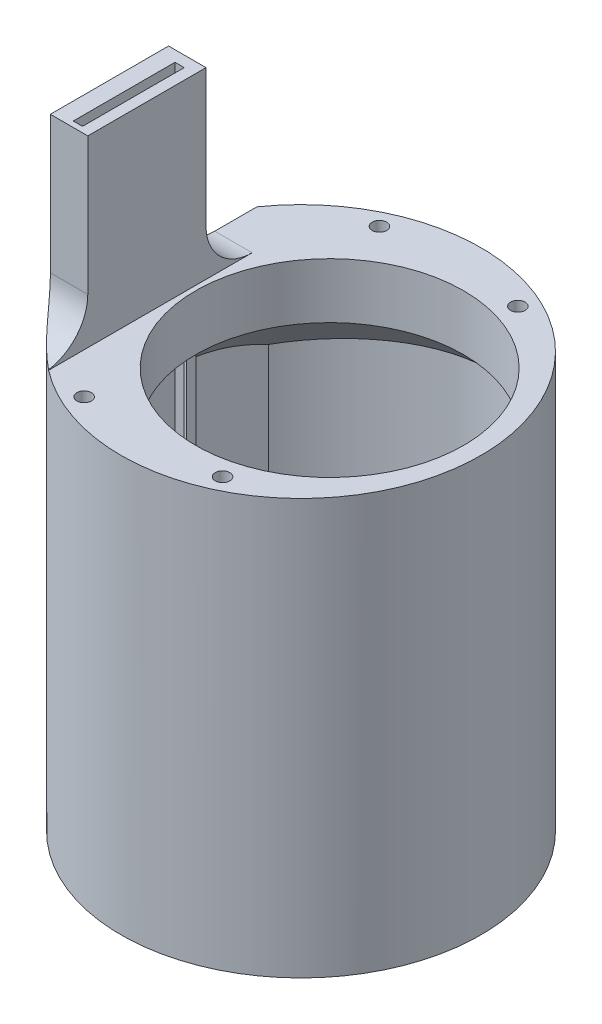
from build123d import *

# Parameters (mm, degrees)
BOSS_EXTRUDE1_DEPTH             = 57.15
SHELL3_T                        = -4.7625
SKETCH2_R                       = 7.9375
CUT_EXTRUDE3_DEPTH              = 7.62
SKETCH10_R                      = 62.285500016
CUT_EXTRUDE4_DEPTH              = 148.876474109
CUT_EXTRUDE5_REACH              = 136.056
SKETCH11_W                      = 2.54
SKETCH11_H                      = 28
SKETCH12_W                      = 10.3025
SKETCH12_H                      = 32.544335252
SKETCH12_W_2                    = 2.54
SKETCH12_H_2                    = 28
BOSS_EXTRUDE3_DEPTH             = 50.4825
FILLET1_R                       = 12.7
CBORE_FOR_M3_SBHCS1_D           = 3.4
CBORE_FOR_M3_SBHCS1_DEPTH       = 10.16
CBORE_FOR_M3_SBHCS1_CBORE_D     = 4
CBORE_FOR_M3_SBHCS1_CBORE_DEPTH = 6
CBORE_FOR_M3_SBHCS1_TIP         = 1.021463052
BOSS_EXTRUDE5_REACH             = 176.679
SKETCH20_R                      = 3.53
BOSS_EXTRUDE6_DEPTH             = 10
FILLET2_R                       = 3
FILLET3_R                       = 2
CBORE_FOR_M3_SHCS1_D            = 3.4
CBORE_FOR_M3_SHCS1_DEPTH        = 7.0000114
CBORE_FOR_M3_SHCS1_CBORE_D      = 4
CBORE_FOR_M3_SHCS1_CBORE_DEPTH  = 6
CBORE_FOR_M3_SHCS1_TIP          = 1.021463052


with BuildPart() as part:
    # Sketch1 → Boss-Extrude1 (new, symmetric)
    with BuildSketch(Plane(origin=(0, 0, 0), x_dir=(1, 0, 0), z_dir=(0, 1, 0))):
        with BuildLine():
            Line((-40.564275689, -28.421126611), (-40.564275689, 28.421126611))
            ThreePointArc((-40.564275689, 28.421126611), (49.53, 0), (-40.564275689, -28.421126611))
        make_face()
    extrude(amount=BOSS_EXTRUDE1_DEPTH, both=True)

    # Shell3
    shell3_openings = [part.faces().sort_by_distance(p)[0] for p in [
        (2.079311546, 57.15, 0),
    ]]
    offset(amount=SHELL3_T, openings=shell3_openings)

    # Sketch2 → Cut-Extrude3 (cut)
    with BuildSketch(Plane.XZ.offset(57.15)):
        with Locations(Location((-21.831775689, -17.8352577, 0), (0, 0, 270))):
            Circle(SKETCH2_R)
    extrude(amount=-CUT_EXTRUDE3_DEPTH, mode=Mode.SUBTRACT)

    # Sketch9 → Revolve1 (revolve)
    with BuildSketch(Plane.XY, mode=Mode.PRIVATE) as revolve1_sk:
        Polygon((-29.003500032, 57.15), (-29.003500032, 41.91), (-54.403500032, 16.51), (-54.403500032, 57.15), align=None)
    revolve(revolve1_sk.sketch.rotate(Axis((7.881999984, 57.15, 0), (0, 1, 0)), 270), axis=Axis((7.881999984, 57.15, 0), (0, 1, 0)))

    # Sketch10 → Cut-Extrude4 (cut, through all)
    with BuildSketch(Plane.XZ.offset(57.15)):
        with Locations((7.881999984, 0)):
            Circle(SKETCH10_R)
        with BuildLine():
            Line((-40.564275689, 28.421126611), (-40.564275689, -28.421126611))
            ThreePointArc((-40.564275689, -28.421126611), (49.53, 0), (-40.564275689, 28.421126611))
        make_face(mode=Mode.SUBTRACT)
    extrude(amount=-CUT_EXTRUDE4_DEPTH, mode=Mode.SUBTRACT)

    # Cut-Extrude5: up to this cone (the profile starts outside it)
    cut_extrude5_end = Plane(origin=(7.881999984, 57.15, 0), z_dir=(0, -1, 0)).offset(-21.645499016) * Cone(1e-06, 179.847000032, 179.846999032, align=(Align.CENTER, Align.CENTER, Align.MIN), mode=Mode.PRIVATE)
    # Sketch11 → Cut-Extrude5 (cut, up to the surface)
    with BuildSketch(Plane(origin=(0, 57.15, 0), x_dir=(1, 0, 0), z_dir=(0, 1, 0)), mode=Mode.PRIVATE) as cut_extrude5_sk1:
        with Locations((-34.531775689, -12.876791359)):
            Rectangle(SKETCH11_W, SKETCH11_H)
    cut_extrude5_tool1 = extrude(cut_extrude5_sk1.sketch, amount=-CUT_EXTRUDE5_REACH, mode=Mode.PRIVATE) - cut_extrude5_end
    add(cut_extrude5_tool1.solids().sort_by_distance((-34.531776, 57.15, 12.876791))[0], mode=Mode.SUBTRACT)

    # Sketch12 → Boss-Extrude3 (add)
    with BuildSketch(Plane(origin=(0, 57.15, 0), x_dir=(1, 0, 0), z_dir=(0, 1, 0))):
        with Locations((-35.413025689, -12.148958985)):
            Rectangle(SKETCH12_W, SKETCH12_H)
        with Locations((-34.531775689, -12.876791359)):
            Rectangle(SKETCH12_W_2, SKETCH12_H_2, mode=Mode.SUBTRACT)
    extrude(amount=BOSS_EXTRUDE3_DEPTH)

    # Fillet1
    # the kernel refuses this fillet: 12.7 mm, written as the material it adds along each edge
    with BuildSketch(Plane(origin=(-40.564275689, 57.15, 28.421126611), x_dir=(0, 1, 0), z_dir=(1, 0, 0))) as fillet1_piece_1_section:
        with BuildLine():
            CenterArc((FILLET1_R, FILLET1_R), FILLET1_R, 180, 90)
            Line((0, FILLET1_R), (0, 0))
            Line((0, 0), (FILLET1_R, 0))
        make_face()
    fillet1_piece_1 = extrude(amount=10.3025, mode=Mode.PRIVATE)
    fillet1_piece_1 = fillet1_piece_1 & Plane(origin=(0, 60.497255445, 0), x_dir=(-0.8189839630344018, 0, -0.5738164064336831), z_dir=(0, 1, 0)) * Cylinder(49.53, 72, mode=Mode.PRIVATE)
    add(fillet1_piece_1)
    with BuildSketch(Plane(origin=(-30.261775689, 57.15, -4.123208641), x_dir=(0, 1, 0), z_dir=(-1, 0, 0))) as fillet1_piece_2:
        with BuildLine():
            CenterArc((FILLET1_R, FILLET1_R), FILLET1_R, 180, 90)
            Line((0, FILLET1_R), (0, 0))
            Line((0, 0), (FILLET1_R, 0))
        make_face()
    extrude(amount=10.3025)

    # CBORE for M3 SBHCS1
    with Locations(Plane(origin=(0, 57.15, 0), x_dir=(1, 0, 0), z_dir=(0, 1, 0))):
        with Locations((-19.05, 40.64), (19.05, 40.64), (19.05, -40.64), (-19.05, -40.64)):
            CounterBoreHole(CBORE_FOR_M3_SBHCS1_D / 2, CBORE_FOR_M3_SBHCS1_CBORE_D / 2, CBORE_FOR_M3_SBHCS1_CBORE_DEPTH, depth=CBORE_FOR_M3_SBHCS1_DEPTH)
            with Locations((0, 0, -(CBORE_FOR_M3_SBHCS1_DEPTH + CBORE_FOR_M3_SBHCS1_TIP / 2))):  # 118° drill point
                Cone(0, CBORE_FOR_M3_SBHCS1_D / 2, CBORE_FOR_M3_SBHCS1_TIP, mode=Mode.SUBTRACT)

    # Boss-Extrude5: up to this cone (the profile starts inside it)
    boss_extrude5_end = Plane(origin=(7.881999984, -52.3875, 0), z_dir=(0, -1, 0)).offset(-131.182999016) * Cone(1e-06, 439.545000032, 439.544999032, align=(Align.CENTER, Align.CENTER, Align.MIN), mode=Mode.PRIVATE)
    # Sketch18 → Boss-Extrude5 (add, up to the surface)
    with BuildSketch(Plane(origin=(0, -52.3875, 0), x_dir=(1, 0, 0), z_dir=(0, 1, 0)), mode=Mode.PRIVATE) as boss_extrude5_sk1:
        with BuildLine():
            Line((-35.801775689, -26.876791359), (-33.261775689, -26.876791359))
            Line((-33.261775689, -26.876791359), (-29.326605326, -23.574791359))
            Line((-29.326605326, -23.574791359), (-29.326605326, -26.114791359))
            Line((-29.326605326, -26.114791359), (-33.540515014, -29.650681423))
            ThreePointArc((-33.540515014, -29.650681423), (-34.698875147, -28.286341576), (-35.801775689, -26.876791359))
        make_face()
    boss_extrude5_tool1 = extrude(boss_extrude5_sk1.sketch, amount=BOSS_EXTRUDE5_REACH, mode=Mode.PRIVATE) & boss_extrude5_end
    add(boss_extrude5_tool1.solids().sort_by_distance((-32.100931, -52.3875, 26.890784))[0])
    # Sketch18 → Boss-Extrude5 (add, up to the surface)
    with BuildSketch(Plane(origin=(0, -52.3875, 0), x_dir=(1, 0, 0), z_dir=(0, 1, 0)), mode=Mode.PRIVATE) as boss_extrude5_sk2:
        Polygon((-35.801775689, 3.663208641), (-33.261775689, 3.663208641), (-29.326605326, 0.361208641), (-29.326605326, -2.178791359), (-33.261775689, 1.123208641), (-35.801775689, 1.123208641), align=None)
    boss_extrude5_tool2 = extrude(boss_extrude5_sk2.sketch, amount=BOSS_EXTRUDE5_REACH, mode=Mode.PRIVATE) & boss_extrude5_end
    add(boss_extrude5_tool2.solids().sort_by_distance((-32.564191, -52.3875, -1.389843))[0])

    # Sketch20 → Boss-Extrude6 (add)
    with BuildSketch(Plane(origin=(0, -57.15, 0), x_dir=(-1, 0, 0), z_dir=(0, -1, 0))):
        with Locations((-27.331300737, 37)):
            Circle(SKETCH20_R)
        with Locations((24.392621835, 39)):
            Circle(SKETCH20_R)
        with Locations((-27.331300737, -37)):
            Circle(SKETCH20_R)
        with Locations((24.392621835, -39)):
            Circle(SKETCH20_R)
    extrude(amount=-BOSS_EXTRUDE6_DEPTH)

    # Fillet2
    fillet2_edges = [part.edges().sort_by_distance(p)[0] for p in [
        (25.233920485, -52.3875, -34.160652174),
        (-22.520753247, -52.3875, -36.007173913),
        (25.233920485, -52.3875, 34.160652174),
        (-22.520753247, -52.3875, 36.007173913),
    ]]
    fillet(fillet2_edges, radius=FILLET2_R)

    # Fillet3
    fillet3_edges = [part.edges().sort_by_distance(p)[0] for p in [
        (25.233920485, -47.15, -34.160652174),
        (-22.520753247, -47.15, -36.007173913),
        (25.233920485, -47.15, 34.160652174),
        (-22.520753247, -47.15, 36.007173913),
    ]]
    fillet(fillet3_edges, radius=FILLET3_R)

    # CBORE for M3 SHCS1
    with Locations(Plane(origin=(0, -57.15, 0), x_dir=(-1, 0, 0), z_dir=(0, -1, 0))):
        with Locations((24.392621835, -39), (-27.331300737, -37), (-27.331300737, 37), (24.392621835, 39)):
            CounterBoreHole(CBORE_FOR_M3_SHCS1_D / 2, CBORE_FOR_M3_SHCS1_CBORE_D / 2, CBORE_FOR_M3_SHCS1_CBORE_DEPTH, depth=CBORE_FOR_M3_SHCS1_DEPTH)
            with Locations((0, 0, -(CBORE_FOR_M3_SHCS1_DEPTH + CBORE_FOR_M3_SHCS1_TIP / 2))):  # 118° drill point
                Cone(0, CBORE_FOR_M3_SHCS1_D / 2, CBORE_FOR_M3_SHCS1_TIP, mode=Mode.SUBTRACT)


solid = part.part
